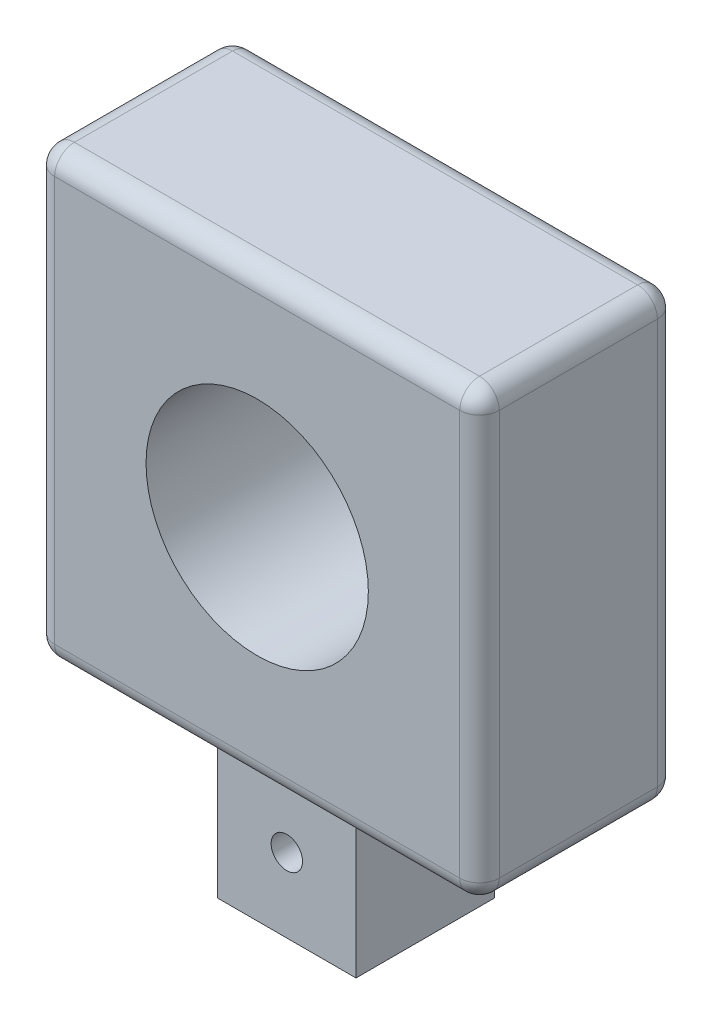
from build123d import *

# Parameters (mm, degrees)
BOSS_EXTRUDE1_DEPTH      = 12.7
BOSS_EXTRUDE1_DEPTH_BACK = 6.35
SKETCH1_W                = 17.78
SKETCH1_H                = 17.78
SKETCH2_W                = 57.15
SKETCH2_H                = 25.4
BOSS_EXTRUDE2_DEPTH      = 57.15
SKETCH3_R                = 14.2875
CUT_EXTRUDE1_DEPTH       = 80.628594895
FILLET1_R                = 2.54
SKETCH4_R                = 2.0193
CUT_EXTRUDE2_DEPTH       = 79.496377146


with BuildPart() as part:
    # Sketch1 → Boss-Extrude1 (new, two sides: drawn at the far end of the back side and taken through both)
    with BuildSketch(Plane(origin=(0, 0, 0), x_dir=(1, 0, 0), z_dir=(0, 1, 0)).offset(-BOSS_EXTRUDE1_DEPTH_BACK)):
        Rectangle(SKETCH1_W, SKETCH1_H)
    extrude(amount=BOSS_EXTRUDE1_DEPTH + BOSS_EXTRUDE1_DEPTH_BACK)

    # Sketch2 → Boss-Extrude2 (add)
    with BuildSketch(Plane(origin=(0, 12.7, 0), x_dir=(1, 0, 0), z_dir=(0, 1, 0))):
        Rectangle(SKETCH2_W, SKETCH2_H)
    extrude(amount=BOSS_EXTRUDE2_DEPTH)

    # Sketch3 → Cut-Extrude1 (cut, through all)
    with BuildSketch(Plane.XY.offset(12.7)):
        with Locations((0, 41.275)):
            Circle(SKETCH3_R)
    extrude(amount=-CUT_EXTRUDE1_DEPTH, mode=Mode.SUBTRACT)

    # Fillet1
    fillet1_edges = [part.edges().sort_by_distance(p)[0] for p in [
        (28.575, 69.85, 0),
        (28.575, 12.7, 0),
        (-28.575, 69.85, 0),
        (-28.575, 12.7, 0),
        (28.575, 41.275, -12.7),
        (0, 69.85, -12.7),
        (-28.575, 41.275, -12.7),
        (0, 12.7, -12.7),
        (-28.575, 41.275, 12.7),
        (0, 69.85, 12.7),
        (28.575, 41.275, 12.7),
        (0, 12.7, 12.7),
    ]]
    fillet(fillet1_edges, radius=FILLET1_R)

    # Sketch4 → Cut-Extrude2 (cut, through all)
    with BuildSketch(Plane(origin=(0, 0, -8.89), x_dir=(-1, 0, 0), z_dir=(0, 0, -1))):
        with Locations((0, 3.175)):
            Circle(SKETCH4_R)
    extrude(amount=-CUT_EXTRUDE2_DEPTH, mode=Mode.SUBTRACT)


solid = part.part
